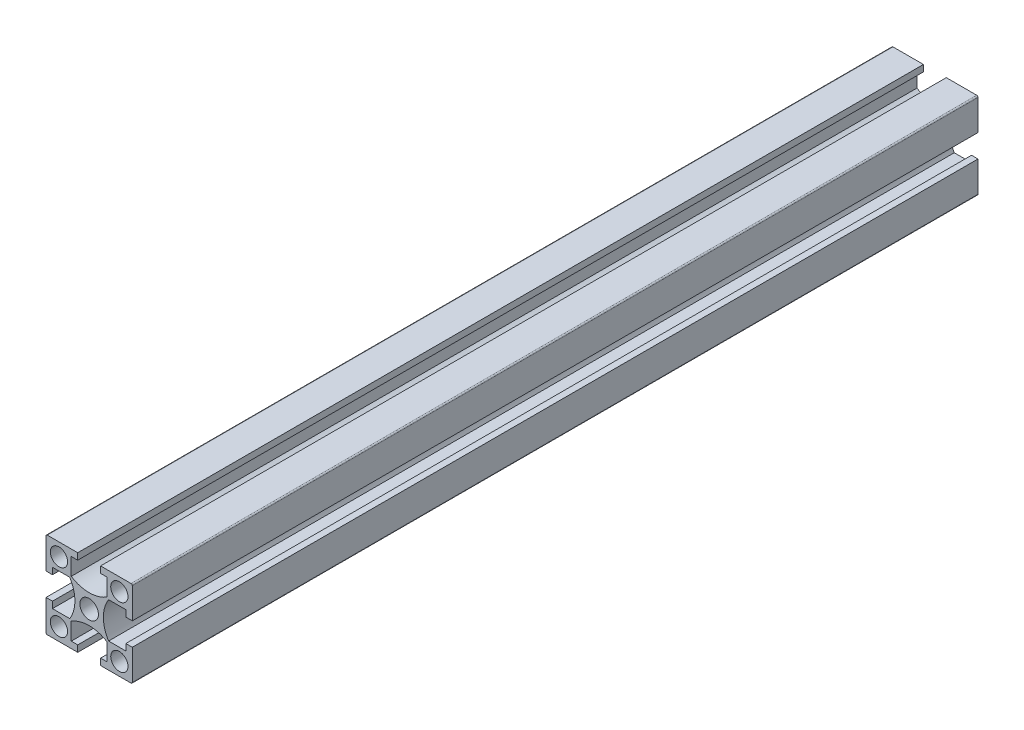
from build123d import *

# Parameters (mm, degrees)
SKETCH_1_W               = 20
SKETCH_1_H               = 20
SKETCH_1_R               = 2
SKETCH_1_R_2             = 2.15
EXTRUDE_1_DEPTH          = 196
CUT_EXTRUDE_1_REACH      = 198.51
PATTERN_CIRCULAR_1_COUNT = 4
FILLET_1_R               = 0.3
SKETCH_2_R               = 2.5
CUT_EXTRUDE_2_DEPTH      = 198.271386673
SKETCH_4_R               = 2.5
CUT_EXTRUDE_4_DEPTH      = 198.271386773


with BuildPart() as part:
    # 스케치1 → 보스-돌출1 (new body)
    with BuildSketch(Plane.XY):
        Rectangle(SKETCH_1_W, SKETCH_1_H)
        with Locations((-7, -7)):
            Circle(SKETCH_1_R, mode=Mode.SUBTRACT)
        with Locations((7, -7)):
            Circle(SKETCH_1_R, mode=Mode.SUBTRACT)
        with Locations((-7, 7)):
            Circle(SKETCH_1_R, mode=Mode.SUBTRACT)
        Circle(SKETCH_1_R_2, mode=Mode.SUBTRACT)
        with Locations((7, 7)):
            Circle(SKETCH_1_R, mode=Mode.SUBTRACT)
    extrude(amount=EXTRUDE_1_DEPTH)

    # 스케치1<3> → 컷-돌출1 (cut, up to next)
    with BuildSketch(Plane.XY, mode=Mode.PRIVATE) as cut_extrude_1_sk1:
        with BuildLine():
            Line((-8.5, 2.65), (-10, 2.65))
            Line((-10, 2.65), (-10, -2.65))
            Line((-10, -2.65), (-8.5, -2.65))
            Line((-8.5, -2.65), (-8.5, -4.15))
            Line((-8.5, -4.15), (-4.503166667, -4.15))
            ThreePointArc((-4.503166667, -4.15), (-3.3, 0), (-4.503166667, 4.15))
            Line((-4.503166667, 4.15), (-8.5, 4.15))
            Line((-8.5, 4.15), (-8.5, 2.65))
        make_face()
    cut_extrude_1_tool1 = extrude(cut_extrude_1_sk1.sketch, amount=CUT_EXTRUDE_1_REACH, mode=Mode.PRIVATE) & part.part
    cut_extrude_1 = cut_extrude_1_tool1.solids().sort_by_distance((-6.606913, 0, 0))[0]
    add(cut_extrude_1, mode=Mode.SUBTRACT)

    # 원형 패턴1: 컷-돌출1 ×4 about axis
    pattern_circular_1_axis = Axis((0, 0, 196), (0, 0, -1))
    for i in range(1, PATTERN_CIRCULAR_1_COUNT):
        add(cut_extrude_1.rotate(pattern_circular_1_axis, i * 360 / PATTERN_CIRCULAR_1_COUNT), mode=Mode.SUBTRACT)

    # 필렛1
    fillet_1_edges = [part.edges().sort_by_distance(p)[0] for p in [
        (10, -10, 98),
        (-10, -10, 98),
        (-10, 10, 98),
        (10, 10, 98),
    ]]
    fillet(fillet_1_edges, radius=FILLET_1_R)

    # 스케치2 → 컷-돌출2 (cut, through all)
    with BuildSketch(Plane.ZY.offset(10)):
        with Locations((11, 0)):
            Circle(SKETCH_2_R)
        with Locations((185, 0)):
            Circle(SKETCH_2_R)
    extrude(amount=-CUT_EXTRUDE_2_DEPTH, mode=Mode.SUBTRACT)

    # 스케치4 → 컷-돌출4 (cut, through all)
    with BuildSketch(Plane.XZ.offset(10)):
        with Locations((0, 98)):
            Circle(SKETCH_4_R)
    extrude(amount=-CUT_EXTRUDE_4_DEPTH, mode=Mode.SUBTRACT)


solid = part.part
